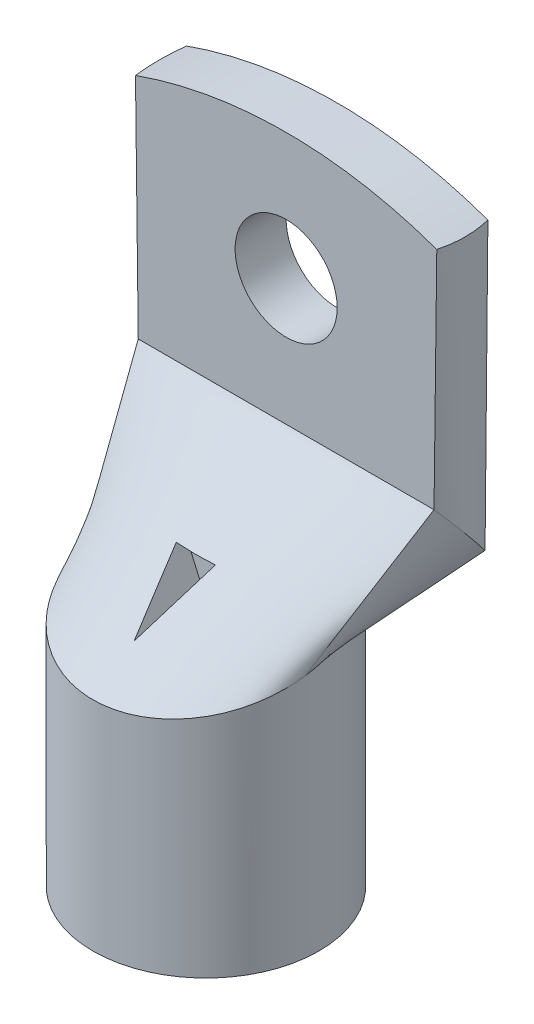
from build123d import *

# Parameters (mm, degrees)
BODY_SHAFT_OUTLINE_R      = 7.75
BODY_SHAFT_DEPTH          = 14.923393759
BODY_SHAFT_START          = 14.923393759
BODY_SHAFT_2_OUTLINE_R    = 7.75
BODY_SHAFT_2_DEPTH        = 4.153212482
BODY_SHAFT_START_2        = 16.420739047
BODY_SHAFT_3_OUTLINE_W    = 18
BODY_SHAFT_3_OUTLINE_H    = 19
BODY_SHAFT_3_DEPTH        = 4.579260953
SKETCH26_W                = 6.5
SKETCH26_H                = 15.057368355
SKETCH9_R                 = 3.5
CUT_HOLE_DEPTH            = 45.218209058
CUT_SHOE_RADIUS_DEPTH     = 45.218209058
CUT_INSPECTION_HOLE_DEPTH = 45.218209058


with BuildPart() as part:
    # Body-Shaft: read off the stored shape, not the designer's step
    # Body-Shaft outline → Body-Shaft (new body)
    with BuildSketch(Plane(origin=(0, 0, 0), x_dir=(1, 0, 0), z_dir=(0, 1, 0))):
        Circle(BODY_SHAFT_OUTLINE_R)
    extrude(amount=BODY_SHAFT_DEPTH)

    # Body-Shaft 2 outline → Body-Shaft 2 (add)
    with BuildSketch(Plane(origin=(0, 0, 0), x_dir=(1, 0, 0), z_dir=(0, 1, 0)).offset(BODY_SHAFT_START)):
        Circle(BODY_SHAFT_2_OUTLINE_R)
    extrude(amount=BODY_SHAFT_2_DEPTH)

    # Body-Shaft 3 outline → Body-Shaft 3 (cut)
    with BuildSketch(Plane(origin=(0, 0, 0), x_dir=(1, 0, 0), z_dir=(0, 0.9659258262890682, 0.2588190451025211)).offset(BODY_SHAFT_START_2)):
        with Locations((0, 4.5)):
            Rectangle(BODY_SHAFT_3_OUTLINE_W, BODY_SHAFT_3_OUTLINE_H)
    extrude(amount=BODY_SHAFT_3_DEPTH, mode=Mode.SUBTRACT)

    # Sketch26 → Cut-Shaft (revolve, cut)
    with BuildSketch(Plane.XY, mode=Mode.PRIVATE) as cut_shaft_sk:
        with Locations((3.25, 7.528684178)):
            Rectangle(SKETCH26_W, SKETCH26_H)
    revolve(cut_shaft_sk.sketch.rotate(Axis((0, 0, 0), (0, 1, 0)), 270), axis=Axis((0, 0, 0), (0, 1, 0)), mode=Mode.SUBTRACT)

    # Body-Transition: read off the stored shape, not the designer's step
    # Body-Transition: loft between two sections, ruled curve by curve
    body_transition_from = [
        Edge.make_bspline([(-7.697082096, 16.75774263, 0.904116814), (-6.240942475, 13.436068349, 13.300773997), (6.240942475, 13.436068349, 13.300773997), (7.697082096, 16.75774263, 0.904116814)], [0, 0, 0, 0, 1, 1, 1, 1], 3, [1, 0.411106823, 0.411106823, 1]),
        Edge.make_bspline([(7.697082096, 16.75774263, 0.904116814), (7.767719964, 16.918878271, 0.302750415), (7.767719964, 17.081121729, -0.302750415), (7.697082096, 17.24225737, -0.904116814)], [0, 0, 0, 0, 1, 1, 1, 1], 3, [1, 0.995447922, 0.995447922, 1]),
        Edge.make_bspline([(-7.697082096, 17.24225737, -0.904116814), (-7.767719964, 17.081121729, -0.302750415), (-7.767719964, 16.918878271, 0.302750415), (-7.697082096, 16.75774263, 0.904116814)], [0, 0, 0, 0, 1, 1, 1, 1], 3, [1, 0.995447922, 0.995447922, 1]),
        Edge.make_bspline([(7.697082096, 17.24225737, -0.904116814), (6.240942475, 20.563931651, -13.300773997), (-6.240942475, 20.563931651, -13.300773997), (-7.697082096, 17.24225737, -0.904116814)], [0, 0, 0, 0, 1, 1, 1, 1], 3, [1, 0.411106823, 0.411106823, 1]),
    ]
    body_transition_to = [
        Edge.make_bspline([(-10.140902466, 24.656520189, -5.5), (-3.380300822, 24.656520189, -5.5), (3.380300822, 24.656520189, -5.5), (10.140902466, 24.656520189, -5.5)], [0, 0, 0, 0, 1, 1, 1, 1], 3),
        Edge.make_bspline([(10.140902466, 24.656520189, -5.5), (10.622491976, 23.282361026, -6.653056447), (10.622491976, 21.859541778, -7.846943553), (10.140902466, 20.485382615, -9)], [0, 0, 0, 0, 1, 1, 1, 1], 3, [1, 0.977200157, 0.977200157, 1]),
        Edge.make_bspline([(-10.140902466, 20.485382615, -9), (-10.622491976, 21.859541778, -7.846943553), (-10.622491976, 23.282361026, -6.653056447), (-10.140902466, 24.656520189, -5.5)], [0, 0, 0, 0, 1, 1, 1, 1], 3, [1, 0.977200157, 0.977200157, 1]),
        Edge.make_bspline([(10.140902466, 20.485382615, -9), (3.380300822, 20.485382615, -9), (-3.380300822, 20.485382615, -9), (-10.140902466, 20.485382615, -9)], [0, 0, 0, 0, 1, 1, 1, 1], 3),
    ]
    body_transition = Solid(Shell([*[Face.make_surface_from_curves(body_transition_from[k], body_transition_to[k]) for k in range(4)], Face(Wire(body_transition_from)), Face(Wire(body_transition_to))]))
    add(body_transition)

    # Sketch11 for Body-Shoe → Body-Shoe section 0
    with BuildSketch(Plane(origin=(0, 12.895701516, -15.368498611), x_dir=(-1, 0, 0), z_dir=(1.0474450083328146e-14, 0.6427876096865438, -0.7660444431189743))):
        with BuildLine():
            Line((10.140902466, 9.90762503), (-10.140902466, 9.90762503))
            # circular arc as an exact rational Bezier (weights 1, cos(half-angle), 1)
            Bezier((-10.140902466, 9.90762503), (-10.871813467, 12.630141727), (-10.140902466, 15.352658424), weights=[1, 0.965800235, 1])
            Line((-10.140902466, 15.352658424), (10.140902466, 15.352658424))
            Bezier((10.140902466, 15.352658424), (10.871813467, 12.630141727), (10.140902466, 9.90762503), weights=[1, 0.965800235, 1])
        make_face()
    # Sketch12 for Body-Shoe → Body-Shoe section 1
    with BuildSketch(Plane(origin=(0, 42, 0), x_dir=(-1, 0, 0), z_dir=(0, 1, 0))):
        with BuildLine():
            Line((-10.35313962, -5.5), (10.35313962, -5.5))
            Bezier((10.35313962, -5.5), (10.64894361, -7.25), (10.35313962, -9), weights=[1, 0.986013297, 1])
            Line((10.35313962, -9), (-10.35313962, -9))
            Bezier((-10.35313962, -9), (-10.64894361, -7.25), (-10.35313962, -5.5), weights=[1, 0.986013297, 1])
        make_face()
    loft()

    # Sketch9 → Cut-Hole (cut, through all)
    with BuildSketch(Plane(origin=(0, 0, 0), x_dir=(-1, 0, 0), z_dir=(0, 0, 1))):
        with Locations(Location((0, -33.328260094, 0), (0, 0, 180))):
            Circle(SKETCH9_R)
    extrude(amount=-CUT_HOLE_DEPTH, mode=Mode.SUBTRACT)

    # Sketch15 → Cut-Shoe-Radius (cut, through all)
    with BuildSketch(Plane.XY):
        with BuildLine():
            Line((10.5, 40.148566703), (10.5, 43.851433297))
            Line((10.5, 43.851433297), (-10.5, 43.851433297))
            Line((-10.5, 43.851433297), (-10.5, 40.148566703))
            ThreePointArc((-10.5, 40.148566703), (0, 42), (10.5, 40.148566703))
        make_face()
    extrude(amount=-CUT_SHOE_RADIUS_DEPTH, mode=Mode.SUBTRACT)

    # Sketch17 → Cut-Inspection-Hole (cut, through all)
    with BuildSketch(Plane.XY):
        Polygon((-1.344278322, 20.074283351), (0, 17), (1.344278322, 20.074283351), align=None)
    extrude(amount=CUT_INSPECTION_HOLE_DEPTH, mode=Mode.SUBTRACT)


solid = part.part
